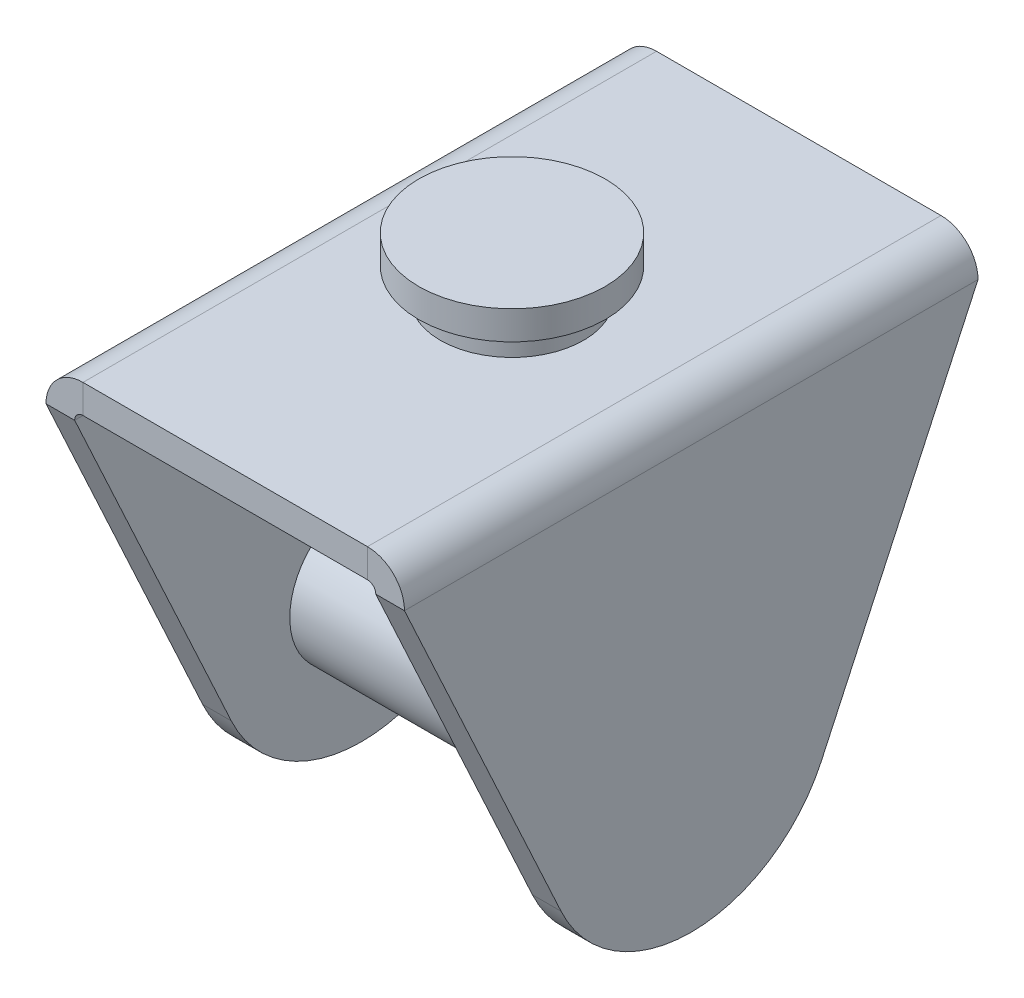
from build123d import *

# Parameters (mm, degrees)
SKETCH2_W                      = 31.75
SKETCH2_H                      = 50.8
BASE_FLANGE1_DEPTH             = 2.54
EDGE_FLANGE1_STRIP_W           = 11.6332
EDGE_FLANGE1_STRIP_H           = 2.54
EDGE_FLANGE1_STRIP_CUT_DEPTH   = 50.8
EDGE_FLANGE1_STRIP_2_W         = 11.6332
EDGE_FLANGE1_STRIP_2_H         = 2.54
EDGE_FLANGE1_STRIP_CUT_2_DEPTH = 50.8
EDGE_FLANGE1_DEPTH             = 50.8
EDGE_FLANGE1_BEND_DEPTH        = 50.8
CUT_EXTRUDE1_DEPTH             = 58.487669113
BOSS_EXTRUDE1_START            = -2.54
SKETCH14_R                     = 6.35
BOSS_EXTRUDE1_DEPTH            = 27.94
SKETCH15_R                     = 6.35
BOSS_EXTRUDE2_DEPTH            = 2.54
SKETCH16_R                     = 8.255
BOSS_EXTRUDE3_DEPTH            = 2.54


# Sheet-metal steps are written as plain solids
with BuildPart() as part:
    # Sketch2 → Base-Flange1 (new body)
    with BuildSketch(Plane(origin=(0, 0, 0), x_dir=(1, 0, 0), z_dir=(0, 1, 0))):
        Rectangle(SKETCH2_W, SKETCH2_H)
    extrude(amount=-BASE_FLANGE1_DEPTH)

    # Edge-Flange1 strip (across the edge) → Edge-Flange1 strip cut (cut)
    with BuildSketch(Plane(origin=(15.875, -2.54, -25.4), x_dir=(-1, 0, 0), z_dir=(0, 0, 1))):
        with Locations((-2.54, -1.27)):
            Rectangle(EDGE_FLANGE1_STRIP_W, EDGE_FLANGE1_STRIP_H)
    extrude(amount=EDGE_FLANGE1_STRIP_CUT_DEPTH, mode=Mode.SUBTRACT)

    # Edge-Flange1 strip 2 (across the edge) → Edge-Flange1 strip cut 2 (cut)
    with BuildSketch(Plane(origin=(-15.875, -2.54, 25.4), x_dir=(1, 0, 0), z_dir=(0, 0, -1))):
        with Locations((-2.54, -1.27)):
            Rectangle(EDGE_FLANGE1_STRIP_2_W, EDGE_FLANGE1_STRIP_2_H)
    extrude(amount=EDGE_FLANGE1_STRIP_CUT_2_DEPTH, mode=Mode.SUBTRACT)

    # Edge-Flange1 section (across the edge) → Edge-Flange1 (add)
    with BuildSketch(Plane(origin=(15.875, -2.54, -25.4), x_dir=(-1, 0, 0), z_dir=(0, 0, 1))):
        with BuildLine():
            Line((0, 0.7366), (0, 38.1))
            Line((0, 38.1), (2.54, 38.1))
            Line((2.54, 38.1), (2.54, 0.7366))
            ThreePointArc((2.54, 0.7366), (2.755745145, 0.215745145), (3.2766, 0))
            Line((3.2766, 0), (3.2766, -2.54))
            ThreePointArc((3.2766, -2.54), (0.959693921, -1.580306079), (0, 0.7366))
        make_face()
    extrude(amount=EDGE_FLANGE1_DEPTH)

    # Edge-Flange1 section 2 (across the edge) → Edge-Flange1 bend (add)
    with BuildSketch(Plane(origin=(-15.875, -2.54, 25.4), x_dir=(1, 0, 0), z_dir=(0, 0, -1))):
        with BuildLine():
            Line((0, 0.7366), (0, 38.1))
            Line((0, 38.1), (2.54, 38.1))
            Line((2.54, 38.1), (2.54, 0.7366))
            ThreePointArc((2.54, 0.7366), (2.755745145, 0.215745145), (3.2766, 0))
            Line((3.2766, 0), (3.2766, -2.54))
            ThreePointArc((3.2766, -2.54), (0.959693921, -1.580306079), (0, 0.7366))
        make_face()
    extrude(amount=EDGE_FLANGE1_BEND_DEPTH)

    # Sketch13 → Cut-Extrude1 (cut, through all)
    with BuildSketch(Plane(origin=(15.875, 0, 0), x_dir=(0, 0, -1), z_dir=(1, 0, 0))):
        with BuildLine():
            Line((-25.4, -40.64), (3e-08, -40.64))
            ThreePointArc((3e-08, -40.64), (-6.840376035, -38.640432501), (-11.526768838, -33.271378824))
            Line((-11.526768838, -33.271378824), (-25.4, -3.2766))
            Line((-25.4, -3.2766), (-25.4, -40.64))
        make_face()
        with BuildLine():
            Line((25.4, -3.2766), (11.526768838, -33.271378824))
            ThreePointArc((11.526768838, -33.271378824), (6.84037606, -38.640432485), (3e-08, -40.64))
            Line((3e-08, -40.64), (25.4, -40.64))
            Line((25.4, -40.64), (25.4, -3.2766))
        make_face()
    extrude(amount=-CUT_EXTRUDE1_DEPTH, mode=Mode.SUBTRACT)

    # Sketch14 → Boss-Extrude1 (add)
    with BuildSketch(Plane(origin=(15.875, 0, 0), x_dir=(0, 0, -1), z_dir=(1, 0, 0)).offset(BOSS_EXTRUDE1_START)):
        with Locations(Location((0, -27.94, 0), (0, 0, 90))):
            Circle(SKETCH14_R)
    extrude(amount=-BOSS_EXTRUDE1_DEPTH)

    # Sketch15 → Boss-Extrude2 (add)
    with BuildSketch(Plane(origin=(0, 0, 0), x_dir=(1, 0, 0), z_dir=(0, 1, 0))):
        with Locations(Location((0, 0, 0), (0, 0, 270))):
            Circle(SKETCH15_R)
    extrude(amount=BOSS_EXTRUDE2_DEPTH)

    # Sketch16 → Boss-Extrude3 (add)
    with BuildSketch(Plane(origin=(0, 2.54, 0), x_dir=(1, 0, 0), z_dir=(0, 1, 0))):
        with Locations(Location((0, 0, 0), (0, 0, 270))):
            Circle(SKETCH16_R)
    extrude(amount=BOSS_EXTRUDE3_DEPTH)


solid = part.part
